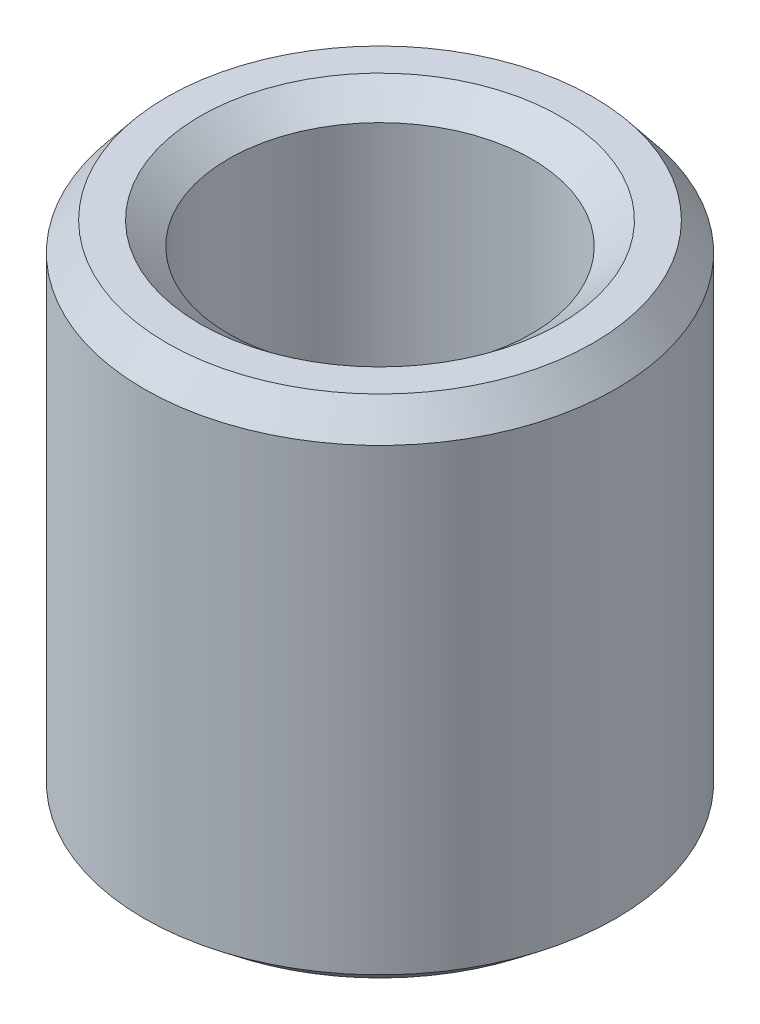
from build123d import *
from OCP.BRepFilletAPI import BRepFilletAPI_MakeChamfer

# Parameters (mm, degrees)
SKETCH1_R           = 20
BOSS_EXTRUDE1_DEPTH = 43.209411331
SKETCH2_R           = 12.845732385
CUT_EXTRUDE1_DEPTH  = 52.643520674
CHAMFER1_SIZE       = 2.408002028
CHAMFER1_SIZE2      = 1.932517604


with BuildPart() as part:
    # Sketch1 → Boss-Extrude1 (new body)
    with BuildSketch(Plane(origin=(0, 0, 0), x_dir=(1, 0, 0), z_dir=(0, 1, 0))):
        Circle(SKETCH1_R)
    extrude(amount=BOSS_EXTRUDE1_DEPTH)

    # Sketch2 → Cut-Extrude1 (cut, through all)
    with BuildSketch(Plane(origin=(0, 0, 0), x_dir=(1, 0, 0), z_dir=(0, 1, 0))):
        Circle(SKETCH2_R)
    extrude(amount=CUT_EXTRUDE1_DEPTH, mode=Mode.SUBTRACT)

    # Chamfer1: one chamfer whose edges measure the first distance from different faces: ONE call of the kernel's chamfer builder (chamfer() names one face for all edges)
    chamfer1_edges_1 = [part.edges().sort_by_distance(p)[0] for p in [
        (-12.845732385, 43.209411331, 0),
    ]]
    chamfer1_side_1 = [part.faces().sort_by_distance(p)[0] for p in [
        (-19.434314575, 43.209411331, 0),
    ]]
    chamfer1_edges_2 = [part.edges().sort_by_distance(p)[0] for p in [
        (-12.845732385, 0, 0),
    ]]
    chamfer1_side_2 = [part.faces().sort_by_distance(p)[0] for p in [
        (-12.845732385, 21.604705666, 0),
    ]]
    chamfer1_edges_3 = [part.edges().sort_by_distance(p)[0] for p in [
        (-20, 0, 0),
    ]]
    chamfer1_side_3 = [part.faces().sort_by_distance(p)[0] for p in [
        (-19.434314575, 0, 0),
    ]]
    chamfer1_edges_4 = [part.edges().sort_by_distance(p)[0] for p in [
        (-20, 43.209411331, 0),
    ]]
    chamfer1_side_4 = [part.faces().sort_by_distance(p)[0] for p in [
        (-20, 21.604705666, 0),
    ]]
    chamfer1 = BRepFilletAPI_MakeChamfer(part.part.solid().wrapped)
    for e in chamfer1_edges_1:
        chamfer1.Add(CHAMFER1_SIZE, CHAMFER1_SIZE2, e.wrapped, chamfer1_side_1[0].wrapped)  # the first distance lies on this face
    for e in chamfer1_edges_2:
        chamfer1.Add(CHAMFER1_SIZE, CHAMFER1_SIZE2, e.wrapped, chamfer1_side_2[0].wrapped)  # the first distance lies on this face
    for e in chamfer1_edges_3:
        chamfer1.Add(CHAMFER1_SIZE, CHAMFER1_SIZE2, e.wrapped, chamfer1_side_3[0].wrapped)  # the first distance lies on this face
    for e in chamfer1_edges_4:
        chamfer1.Add(CHAMFER1_SIZE, CHAMFER1_SIZE2, e.wrapped, chamfer1_side_4[0].wrapped)  # the first distance lies on this face
    add(Compound.cast(chamfer1.Shape()), mode=Mode.REPLACE)


solid = part.part
